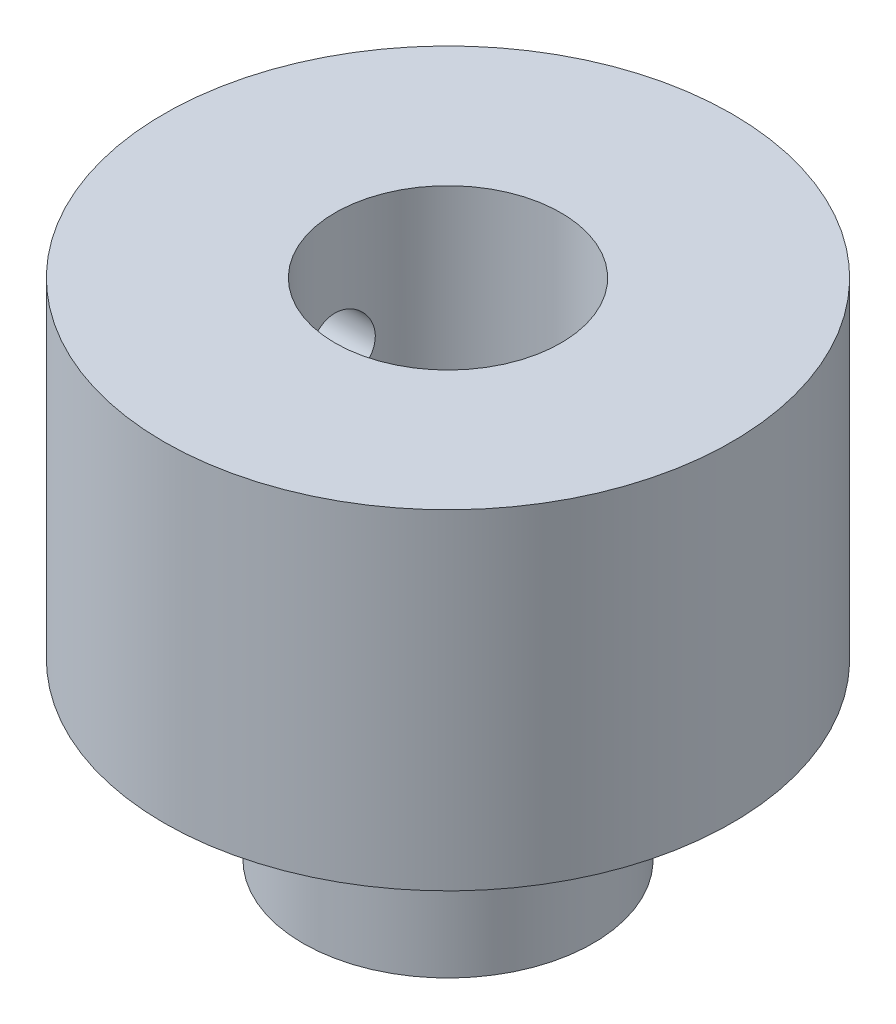
from build123d import *

# Parameters (mm, degrees)
BOSS_EXTRUDE1_DEPTH      = 6.5
BOSS_EXTRUDE1_DEPTH_BACK = 3
SKETCH1_R                = 8.175
SKETCH1_R_2              = 3.25
SKETCH1_3_R              = 8.175
SKETCH1_3_R_2            = 3.25
BOSS_EXTRUDE2_DEPTH      = 3
SKETCH2_R                = 1
CUT_EXTRUDE1_DEPTH       = 15
SKETCH4_R                = 4.175
BOSS_EXTRUDE4_DEPTH      = 5
CUT_EXTRUDE3_DEPTH       = 15
CUT_EXTRUDE3_DEPTH_BACK  = 13
SKETCH1_5_R              = 3.25


with BuildPart() as part:
    # Sketch1 → Boss-Extrude1 (new, two sides: drawn at the far end of the back side and taken through both)
    with BuildSketch(Plane(origin=(0, 0, 0), x_dir=(1, 0, 0), z_dir=(0, 1, 0)).offset(-BOSS_EXTRUDE1_DEPTH_BACK)):
        Circle(SKETCH1_R)
        Circle(SKETCH1_R_2, mode=Mode.SUBTRACT)
    extrude(amount=BOSS_EXTRUDE1_DEPTH + BOSS_EXTRUDE1_DEPTH_BACK)

    # Sketch2 → Cut-Extrude1 (cut)
    with BuildSketch(Plane(origin=(0, 0, 0), x_dir=(0, 0, -1), z_dir=(1, 0, 0))):
        with Locations((0, 3)):
            Circle(SKETCH2_R)
    extrude(amount=-CUT_EXTRUDE1_DEPTH, mode=Mode.SUBTRACT)



with BuildPart() as body_2:
    # Sketch1<3> → Boss-Extrude2 (new body)
    with BuildSketch(Plane(origin=(0, 0, 0), x_dir=(1, 0, 0), z_dir=(0, 1, 0))):
        Circle(SKETCH1_3_R)
        Circle(SKETCH1_3_R_2, mode=Mode.SUBTRACT)
    extrude(amount=-BOSS_EXTRUDE2_DEPTH)


with BuildPart() as part_1:
    add(part.part)

    add(body_2.part)  # Boss-Extrude4 merges body 2
    # Sketch4 → Boss-Extrude4 (add)
    with BuildSketch(Plane.XZ.offset(3)):
        Circle(SKETCH4_R)
    extrude(amount=BOSS_EXTRUDE4_DEPTH)

    # Sketch1<5> → Cut-Extrude3 (cut, two sides: drawn at the far end of the back side and taken through both)
    with BuildSketch(Plane(origin=(0, 0, 0), x_dir=(1, 0, 0), z_dir=(0, 1, 0)).offset(-CUT_EXTRUDE3_DEPTH_BACK)):
        Circle(SKETCH1_5_R)
    extrude(amount=CUT_EXTRUDE3_DEPTH + CUT_EXTRUDE3_DEPTH_BACK, mode=Mode.SUBTRACT)


solid = part_1.part
